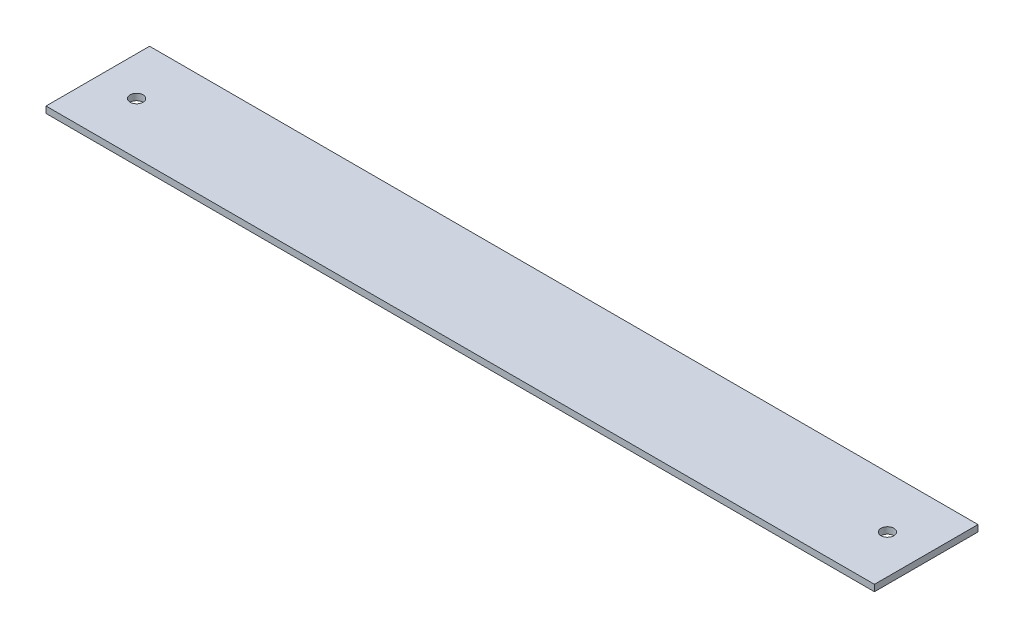
from build123d import *

# Parameters (mm, degrees)
SKETCH1_W           = 406.4
SKETCH1_H           = 50.8
BOSS_EXTRUDE1_DEPTH = 3.175
SKETCH2_R           = 3.175
CUT_EXTRUDE1_DEPTH  = 24.638


with BuildPart() as part:
    # Sketch1 → Boss-Extrude1 (new body)
    with BuildSketch(Plane(origin=(0, 0, 0), x_dir=(1, 0, 0), z_dir=(0, 1, 0))):
        with Locations((203.2, 25.4)):
            Rectangle(SKETCH1_W, SKETCH1_H)
    extrude(amount=BOSS_EXTRUDE1_DEPTH)

    # Sketch2 → Cut-Extrude1 (cut)
    with BuildSketch(Plane(origin=(0, 0, 0), x_dir=(-1, 0, 0), z_dir=(0, -1, 0))):
        with Locations((-387.35, 25.4)):
            Circle(SKETCH2_R)
        with Locations((-19.05, 25.4)):
            Circle(SKETCH2_R)
    extrude(amount=-CUT_EXTRUDE1_DEPTH, mode=Mode.SUBTRACT)


solid = part.part
